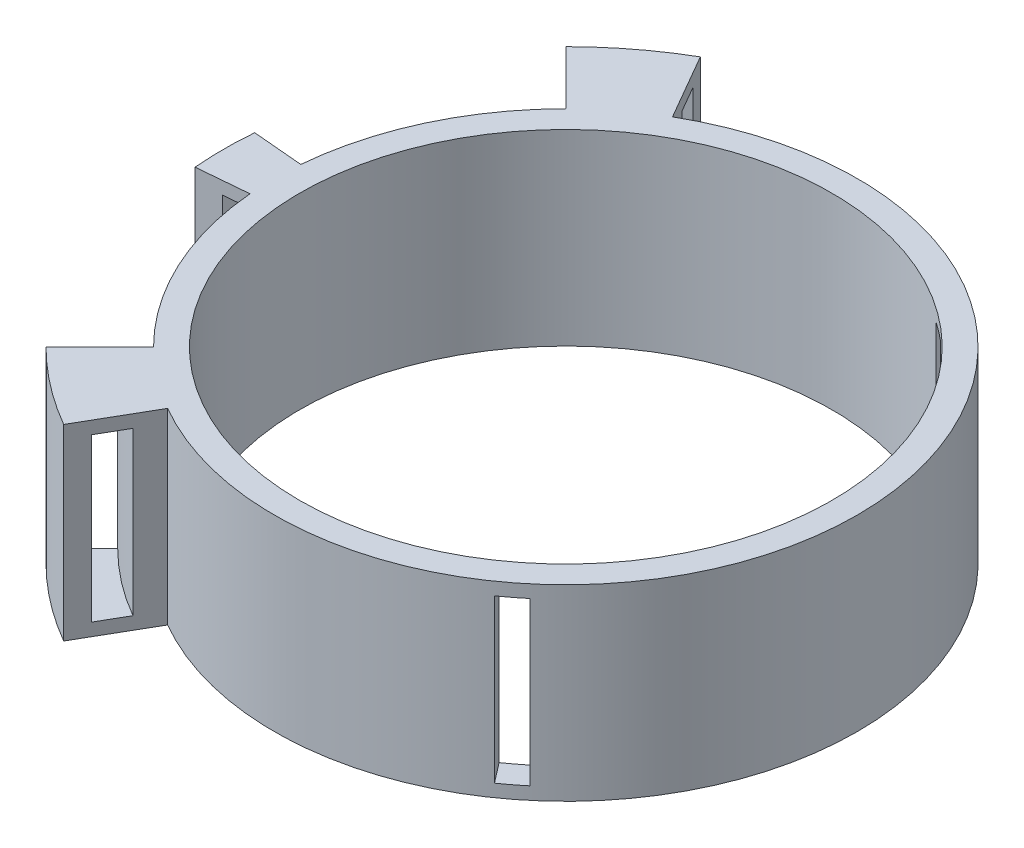
from build123d import *
from build123d.topology import SkipClean

# Parameters (mm, degrees)
EXTRUDE_1_DEPTH = 0.5
EXTRUDE_2_DEPTH = 6.4
EXTRUDE_3_DEPTH = 0.5
EXTRUDE_4_DEPTH = 6.4
EXTRUDE_5_DEPTH = 0.5
EXTRUDE_START   = -7.4
EXTRUDE_6_DEPTH = 7.4


with BuildPart() as part:
    # 草图1 → 凸台-拉伸1 (new body)
    with BuildSketch(Plane(origin=(0, 0, 0), x_dir=(1, 0, 0), z_dir=(0, 1, 0))):
        with BuildLine():
            Line((11.456239028, 1.002291042), (10.46004433, 0.915135299))
            ThreePointArc((10.46004433, 0.915135299), (-10.5, 0), (10.46004433, -0.915135299))
            Line((10.46004433, -0.915135299), (11.456239028, -1.002291042))
            ThreePointArc((11.456239028, -1.002291042), (5.310109052, -10.200624582), (-5.75, -9.959292144))
            Line((-5.75, -9.959292144), (-7.25, -12.557368355))
            ThreePointArc((-7.25, -12.557368355), (-8.827040721, -11.503623434), (-10.253048327, -10.253048327))
            Line((-10.253048327, -10.253048327), (-8.131727984, -8.131727984))
            ThreePointArc((-8.131727984, -8.131727984), (-10.422539551, -4.86011001), (-11.456239028, -1.002291042))
            Line((-11.456239028, -1.002291042), (-13.448628424, -1.176602527))
            ThreePointArc((-13.448628424, -1.176602527), (-13.5, 0), (-13.448628424, 1.176602527))
            Line((-13.448628424, 1.176602527), (-11.456239028, 1.002291042))
            ThreePointArc((-11.456239028, 1.002291042), (-10.422539551, 4.86011001), (-8.131727984, 8.131727984))
            Line((-8.131727984, 8.131727984), (-10.253048327, 10.253048327))
            ThreePointArc((-10.253048327, 10.253048327), (-8.827040721, 11.503623434), (-7.25, 12.557368355))
            Line((-7.25, 12.557368355), (-5.75, 9.959292144))
            ThreePointArc((-5.75, 9.959292144), (5.310109052, 10.200624582), (11.456239028, 1.002291042))
        make_face()
    extrude(amount=EXTRUDE_1_DEPTH)

    # 草图10 → 凸台-拉伸2 (add)
    with SkipClean():  # the faces are left unmerged after this step: merging them gives an invalid solid
        with BuildSketch(Plane(origin=(0, 0.5, 0), x_dir=(1, 0, 0), z_dir=(0, 1, 0))):
            with BuildLine():
                Line((6.601509895, -9.416478488), (5.991894646, -8.622482157))
                ThreePointArc((5.991894646, -8.622482157), (-10.499966218, -0.026634823), (5.94807324, 8.652769772))
                Line((5.94807324, 8.652769772), (6.553696854, 9.449817858))
                ThreePointArc((6.553696854, 9.449817858), (-11.49996307, -0.02914447), (6.601509895, -9.416478488))
            make_face()
            with BuildLine():
                Line((11.456239028, -1.002291042), (10.46004433, -0.915135299))
                ThreePointArc((10.46004433, -0.915135299), (9.313613748, -4.848360439), (6.749269902, -8.043466653))
                Line((6.749269902, -8.043466653), (7.392057511, -8.809511096))
                ThreePointArc((7.392057511, -8.809511096), (10.200624582, -5.310109052), (11.456239028, -1.002291042))
            make_face()
            with BuildLine():
                Line((7.348181349, 8.846142146), (6.709209057, 8.076912394))
                ThreePointArc((6.709209057, 8.076912394), (9.301536339, 4.87149071), (10.46004433, 0.915135299))
                Line((10.46004433, 0.915135299), (11.456239028, 1.002291042))
                ThreePointArc((11.456239028, 1.002291042), (10.187396942, 5.335442206), (7.348181349, 8.846142146))
            make_face()
        extrude(amount=EXTRUDE_2_DEPTH)

    # 草图11 → 凸台-拉伸3 (add)
    with BuildSketch(Plane(origin=(0, 6.9, 0), x_dir=(1, 0, 0), z_dir=(0, 1, 0))):
        with BuildLine():
            Line((10.46004433, 0.915135299), (11.456239028, 1.002291042))
            ThreePointArc((11.456239028, 1.002291042), (-11.5, 0), (11.456239028, -1.002291042))
            Line((11.456239028, -1.002291042), (10.46004433, -0.915135299))
            ThreePointArc((10.46004433, -0.915135299), (-10.5, 0), (10.46004433, 0.915135299))
        make_face()
    extrude(amount=EXTRUDE_3_DEPTH)

    # 草图12 → 凸台-拉伸4 (add)
    with SkipClean():  # the faces are left unmerged after this step: merging them gives an invalid solid
        with BuildSketch(Plane(origin=(0, 0.5, 0), x_dir=(1, 0, 0), z_dir=(0, 1, 0))):
            with BuildLine():
                Line((-8.131727984, -8.131727984), (-8.838834765, -8.838834765))
                ThreePointArc((-8.838834765, -8.838834765), (-7.609517863, -9.916916754), (-6.25, -10.825317547))
                Line((-6.25, -10.825317547), (-5.75, -9.959292144))
                ThreePointArc((-5.75, -9.959292144), (-7.000756434, -9.123563413), (-8.131727984, -8.131727984))
            make_face()
            with BuildLine():
                Line((-10.253048327, -10.253048327), (-9.687362902, -9.687362902))
                ThreePointArc((-9.687362902, -9.687362902), (-8.340031577, -10.868940762), (-6.85, -11.864548032))
                Line((-6.85, -11.864548032), (-7.25, -12.557368355))
                ThreePointArc((-7.25, -12.557368355), (-8.827040721, -11.503623434), (-10.253048327, -10.253048327))
            make_face()
            with BuildLine():
                Line((-10.253048327, 10.253048327), (-9.687362902, 9.687362902))
                ThreePointArc((-9.687362902, 9.687362902), (-8.340031577, 10.868940762), (-6.85, 11.864548032))
                Line((-6.85, 11.864548032), (-7.25, 12.557368355))
                ThreePointArc((-7.25, 12.557368355), (-8.827040721, 11.503623434), (-10.253048327, 10.253048327))
            make_face()
            with BuildLine():
                Line((-5.75, 9.959292144), (-6.25, 10.825317547))
                ThreePointArc((-6.25, 10.825317547), (-7.609517863, 9.916916754), (-8.838834765, 8.838834765))
                Line((-8.838834765, 8.838834765), (-8.131727984, 8.131727984))
                ThreePointArc((-8.131727984, 8.131727984), (-7.000756434, 9.123563413), (-5.75, 9.959292144))
            make_face()
            with BuildLine():
                Line((-13.448628424, 1.176602527), (-12.452433726, 1.089446784))
                ThreePointArc((-12.452433726, 1.089446784), (-12.5, 0), (-12.452433726, -1.089446784))
                Line((-12.452433726, -1.089446784), (-13.448628424, -1.176602527))
                ThreePointArc((-13.448628424, -1.176602527), (-13.5, 0), (-13.448628424, 1.176602527))
            make_face()
        extrude(amount=EXTRUDE_4_DEPTH)

    # 草图13 → 凸台-拉伸5 (add)
    with BuildSketch(Plane(origin=(0, 6.9, 0), x_dir=(1, 0, 0), z_dir=(0, 1, 0))):
        with BuildLine():
            Line((-8.131727984, -8.131727984), (-10.253048327, -10.253048327))
            ThreePointArc((-10.253048327, -10.253048327), (-8.827040721, -11.503623434), (-7.25, -12.557368355))
            Line((-7.25, -12.557368355), (-5.75, -9.959292144))
            ThreePointArc((-5.75, -9.959292144), (-7.000756434, -9.123563413), (-8.131727984, -8.131727984))
        make_face()
        with BuildLine():
            Line((-7.25, 12.557368355), (-5.75, 9.959292144))
            ThreePointArc((-5.75, 9.959292144), (-7.000756434, 9.123563413), (-8.131727984, 8.131727984))
            Line((-8.131727984, 8.131727984), (-10.253048327, 10.253048327))
            ThreePointArc((-10.253048327, 10.253048327), (-8.827040721, 11.503623434), (-7.25, 12.557368355))
        make_face()
        with BuildLine():
            Line((-13.448628424, 1.176602527), (-11.456239028, 1.002291042))
            ThreePointArc((-11.456239028, 1.002291042), (-11.5, 0), (-11.456239028, -1.002291042))
            Line((-11.456239028, -1.002291042), (-13.448628424, -1.176602527))
            ThreePointArc((-13.448628424, -1.176602527), (-13.5, 0), (-13.448628424, 1.176602527))
        make_face()
    extrude(amount=EXTRUDE_5_DEPTH)

    # 草图14 → 凸台-拉伸6 (add)
    with BuildSketch(Plane(origin=(0, 7.4, 0), x_dir=(1, 0, 0), z_dir=(0, 1, 0)).offset(EXTRUDE_START)):
        with BuildLine():
            Line((10.46004433, 0.915135299), (11.456239028, 1.002291042))
            ThreePointArc((11.456239028, 1.002291042), (11.5, 0), (11.456239028, -1.002291042))
            Line((11.456239028, -1.002291042), (10.46004433, -0.915135299))
            ThreePointArc((10.46004433, -0.915135299), (10.5, 0), (10.46004433, 0.915135299))
        make_face()
    extrude(amount=EXTRUDE_6_DEPTH)


solid = part.part
